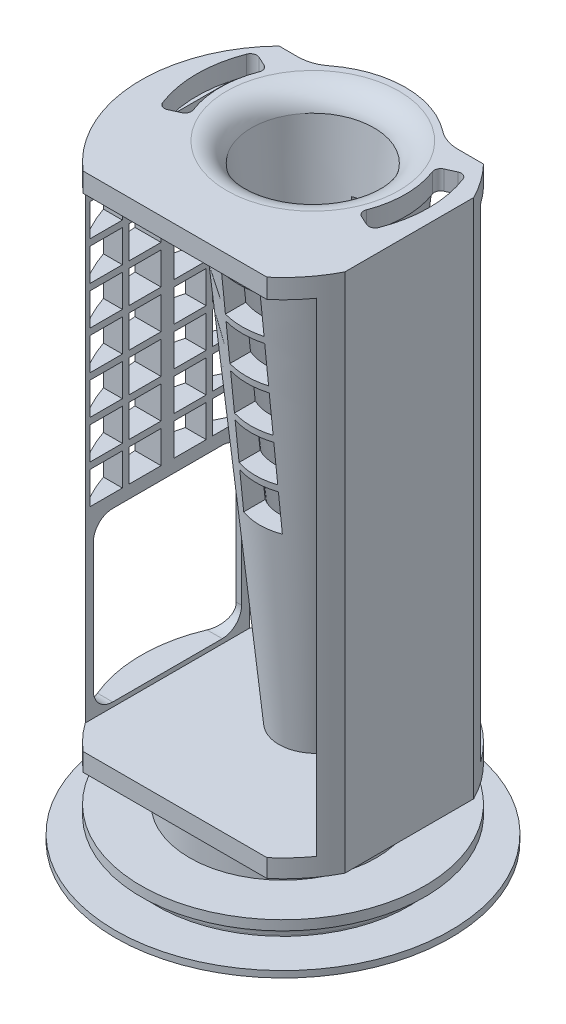
from build123d import *
from OCP.BRepFilletAPI import BRepFilletAPI_MakeChamfer

# Parameters (mm, degrees)
SKETCH_1_R                  = 9.5
EXTRUDE_1415_DEPTH          = 3
EXTRUDE_START               = -75
EXTRUDE_2148_DEPTH          = 75
EXTRUDE_START_2             = 2.8
EXTRUDE_2567_DEPTH          = 2.8
SKETCH_4_W                  = 5
SKETCH_4_H                  = 5
CUT_EXTRUDE_3719_DEPTH      = 89.815402046
CUT_EXTRUDE_4681_DEPTH      = 84.757719939
CUT_EXTRUDE_4681_DEPTH_BACK = 84.757719939
SKETCH_8_W                  = 6
SKETCH_8_H                  = 6
FILLET_4802_R               = 4
SKETCH_9_R                  = 14.480079495
EXTRUDE_4972_DEPTH          = 5.5
EXTRUDE_START_3             = 1.5
SKETCH_10_R                 = 22
EXTRUDE_5057_DEPTH          = 1.5
SKETCH_11_R                 = 19.5
EXTRUDE_5142_DEPTH          = 2.5
SKETCH_12_R                 = 26
EXTRUDE_5232_DEPTH          = 1
SKETCH_13_R                 = 12
CUT_EXTRUDE_5309_DEPTH      = 11
CHAMFER_5348_SIZE           = 8
CHAMFER_5348_SIZE2          = 5
EXTRUDE_START_4             = 5
EXTRUDE_5618_DEPTH          = 3
CHAMFER_2_SIZE              = 2
CHAMFER_2_SIZE2             = 0.8
FILLET_1_R                  = 2
FILLET_2_R                  = 2.3


with BuildPart() as part:
    # Эскиз1 → Extrude 1415 (new body)
    with BuildSketch(Plane(origin=(0, 0, 0), x_dir=(1, 0, 0), z_dir=(0, 1, 0))):
        with BuildLine():
            Line((11.923898026, 15.25), (15.856780884, 15.25))
            ThreePointArc((15.856780884, 15.25), (17.922262053, 12.759017318), (19.6, 9.991996797))
            Line((19.6, 9.991996797), (19.6, -9.991996797))
            ThreePointArc((19.6, -9.991996797), (17.265454373, -13.63466484), (14.263151826, -16.75))
            Line((14.263151826, -16.75), (-14.263151826, -16.75))
            ThreePointArc((-14.263151826, -16.75), (-21.972769207, -1.094263859), (-15.856780884, 15.25))
            Line((-15.856780884, 15.25), (-12.923898026, 15.25))
            ThreePointArc((-12.923898026, 15.25), (-11.011274358, 15.568089332), (-9.304561701, 16.488112173))
            ThreePointArc((-9.304561701, 16.488112173), (-0.5, 19.5), (8.304561701, 16.488112173))
            ThreePointArc((8.304561701, 16.488112173), (10.011274358, 15.568089332), (11.923898026, 15.25))
        make_face()
        with Locations(Location((-0.5, 5.125, 0), (0, 0, 270))):
            Circle(SKETCH_1_R, mode=Mode.SUBTRACT)
        with BuildLine():
            ThreePointArc((-17.280882687, 11.649449245), (-18.504623343, 5.125), (-17.280882687, -1.399449245))
            ThreePointArc((-17.280882687, -1.399449245), (-16.724559325, -1.963810812), (-15.932291149, -1.946181296))
            Line((-15.932291149, -1.946181296), (-14.447945449, -1.266043949))
            ThreePointArc((-14.447945449, -1.266043949), (-13.938944916, -0.73553603), (-13.930228365, -0.000386918))
            ThreePointArc((-13.930228365, -0.000386918), (-14.875, 5.125), (-13.930228365, 10.250386918))
            ThreePointArc((-13.930228365, 10.250386918), (-13.938944916, 10.98553603), (-14.447945449, 11.516043949))
            Line((-14.447945449, 11.516043949), (-15.932291149, 12.196181296))
            ThreePointArc((-15.932291149, 12.196181296), (-16.724559325, 12.213810812), (-17.280882687, 11.649449245))
        make_face(mode=Mode.SUBTRACT)
        with BuildLine():
            ThreePointArc((16.280882687, 11.649449245), (15.724559325, 12.213810812), (14.932291149, 12.196181296))
            Line((14.932291149, 12.196181296), (13.447945449, 11.516043949))
            ThreePointArc((13.447945449, 11.516043949), (12.938944916, 10.98553603), (12.930228365, 10.250386918))
            ThreePointArc((12.930228365, 10.250386918), (13.875, 5.125), (12.930228365, -0.000386918))
            ThreePointArc((12.930228365, -0.000386918), (12.938944916, -0.73553603), (13.447945449, -1.266043949))
            Line((13.447945449, -1.266043949), (14.932291149, -1.946181296))
            ThreePointArc((14.932291149, -1.946181296), (15.724559325, -1.963810812), (16.280882687, -1.399449245))
            ThreePointArc((16.280882687, -1.399449245), (17.504623343, 5.125), (16.280882687, 11.649449245))
        make_face(mode=Mode.SUBTRACT)
    extrude(amount=EXTRUDE_1415_DEPTH)

    # Эскиз2 → Extrude 2148 (add)
    with BuildSketch(Plane(origin=(0, 0, 0), x_dir=(1, 0, 0), z_dir=(0, 1, 0)).offset(EXTRUDE_START)):
        with BuildLine():
            Line((-17.922262053, -12.759017318), (-17.922262053, 12.759017318))
            ThreePointArc((-17.922262053, 12.759017318), (-22, 0), (-17.922262053, -12.759017318))
        make_face()
        with BuildLine():
            Line((17.922262053, -12.759017318), (17.922262053, 12.759017318))
            ThreePointArc((17.922262053, 12.759017318), (18.812074262, 11.406395661), (19.6, 9.991996797))
            Line((19.6, 9.991996797), (19.6, -9.991996797))
            ThreePointArc((19.6, -9.991996797), (18.812074262, -11.406395661), (17.922262053, -12.759017318))
        make_face()
    extrude(amount=EXTRUDE_2148_DEPTH)

    # Эскиз3 → Extrude 2567 (add)
    with BuildSketch(Plane(origin=(0, -75, 0), x_dir=(-1, 0, 0), z_dir=(0, -1, 0)).offset(EXTRUDE_START_2)):
        with BuildLine():
            Line((-14.263151826, -16.75), (14.263151826, -16.75))
            ThreePointArc((14.263151826, -16.75), (21.972769207, -1.094263859), (15.856780884, 15.25))
            Line((15.856780884, 15.25), (-7.52226754, 20.674029386))
            ThreePointArc((-7.52226754, 20.674029386), (-14.575006147, 16.479356657), (-19.6, 9.991996797))
            Line((-19.6, 9.991996797), (-19.6, -9.991996797))
            ThreePointArc((-19.6, -9.991996797), (-17.265454373, -13.63466484), (-14.263151826, -16.75))
        make_face()
    extrude(amount=-EXTRUDE_2567_DEPTH)

    # Эскиз4 → Cut-Extrude 3719 (cut, through all)
    with BuildSketch(Plane(origin=(-17.922262053, 0, 0), x_dir=(0, 0, -1), z_dir=(1, 0, 0))):
        with BuildLine():
            Line((8.5, -74.3), (-8.5, -74.3))
            ThreePointArc((-8.5, -74.3), (-10.621320344, -73.421320344), (-11.5, -71.3))
            Line((-11.5, -71.3), (-11.5, -51.3))
            ThreePointArc((-11.5, -51.3), (-10.621320344, -49.178679656), (-8.5, -48.3))
            Line((-8.5, -48.3), (8.5, -48.3))
            ThreePointArc((8.5, -48.3), (10.621320344, -49.178679656), (11.5, -51.3))
            Line((11.5, -51.3), (11.5, -71.3))
            ThreePointArc((11.5, -71.3), (10.621320344, -73.421320344), (8.5, -74.3))
        make_face()
        with Locations((9.5, -43.8)):
            Rectangle(SKETCH_4_W, SKETCH_4_H)
        with Locations((3.5, -43.8)):
            Rectangle(SKETCH_4_W, SKETCH_4_H)
        with Locations((-3.5, -43.8)):
            Rectangle(SKETCH_4_W, SKETCH_4_H)
        with Locations((-9.5, -43.8)):
            Rectangle(SKETCH_4_W, SKETCH_4_H)
        with Locations((9.5, -37.8)):
            Rectangle(SKETCH_4_W, SKETCH_4_H)
        with Locations((3.5, -37.8)):
            Rectangle(SKETCH_4_W, SKETCH_4_H)
        with Locations((-3.5, -37.8)):
            Rectangle(SKETCH_4_W, SKETCH_4_H)
        with Locations((-9.5, -37.8)):
            Rectangle(SKETCH_4_W, SKETCH_4_H)
        with Locations((9.5, -31.8)):
            Rectangle(SKETCH_4_W, SKETCH_4_H)
        with Locations((3.5, -31.8)):
            Rectangle(SKETCH_4_W, SKETCH_4_H)
        with Locations((-3.5, -31.8)):
            Rectangle(SKETCH_4_W, SKETCH_4_H)
        with Locations((-9.5, -31.8)):
            Rectangle(SKETCH_4_W, SKETCH_4_H)
        with Locations((9.5, -25.8)):
            Rectangle(SKETCH_4_W, SKETCH_4_H)
        with Locations((3.5, -25.8)):
            Rectangle(SKETCH_4_W, SKETCH_4_H)
        with Locations((-3.5, -25.8)):
            Rectangle(SKETCH_4_W, SKETCH_4_H)
        with Locations((-9.5, -25.8)):
            Rectangle(SKETCH_4_W, SKETCH_4_H)
        with Locations((9.5, -19.8)):
            Rectangle(SKETCH_4_W, SKETCH_4_H)
        with Locations((3.5, -19.8)):
            Rectangle(SKETCH_4_W, SKETCH_4_H)
        with Locations((-3.5, -19.8)):
            Rectangle(SKETCH_4_W, SKETCH_4_H)
        with Locations((-9.5, -19.8)):
            Rectangle(SKETCH_4_W, SKETCH_4_H)
        with Locations((9.5, -13.8)):
            Rectangle(SKETCH_4_W, SKETCH_4_H)
        with Locations((3.5, -13.8)):
            Rectangle(SKETCH_4_W, SKETCH_4_H)
        with Locations((-3.5, -13.8)):
            Rectangle(SKETCH_4_W, SKETCH_4_H)
        with Locations((-9.5, -13.8)):
            Rectangle(SKETCH_4_W, SKETCH_4_H)
        with Locations((9.5, -7.8)):
            Rectangle(SKETCH_4_W, SKETCH_4_H)
        with Locations((3.5, -7.8)):
            Rectangle(SKETCH_4_W, SKETCH_4_H)
        with Locations((-3.5, -7.8)):
            Rectangle(SKETCH_4_W, SKETCH_4_H)
        with Locations((-9.5, -7.8)):
            Rectangle(SKETCH_4_W, SKETCH_4_H)
    extrude(amount=-CUT_EXTRUDE_3719_DEPTH, mode=Mode.SUBTRACT)

    # Эскиз7 → Revolve 4422 (revolve)
    with BuildSketch(Plane(origin=(0, 0, -5.125), x_dir=(-1, 0, 0), z_dir=(0, 0, -1)), mode=Mode.PRIVATE) as revolve_4422_sk:
        Polygon((2.735961845, -75), (10, 0), (13.014038155, 0), (5.75, -75), align=None)
    revolve(revolve_4422_sk.sketch.rotate(Axis((0, 0, -5.125), (0, -1, 0)), 270), axis=Axis((0, 0, -5.125), (0, -1, 0)))

    # Эскиз8 → Cut-Extrude 4681 (cut, two sides: drawn at the far end of the back side and taken through both)
    with BuildSketch(Plane(origin=(0, 0, -5.125), x_dir=(-1, 0, 0), z_dir=(0, 0, -1)).offset(-CUT_EXTRUDE_4681_DEPTH_BACK)):
        with Locations((0, -13)):
            Rectangle(SKETCH_8_W, SKETCH_8_H)
        with Locations((0, -20)):
            Rectangle(SKETCH_8_W, SKETCH_8_H)
        with Locations((0, -27)):
            Rectangle(SKETCH_8_W, SKETCH_8_H)
        with Locations((0, -34)):
            Rectangle(SKETCH_8_W, SKETCH_8_H)
        with Locations((0, -41)):
            Rectangle(SKETCH_8_W, SKETCH_8_H)
    extrude(amount=CUT_EXTRUDE_4681_DEPTH + CUT_EXTRUDE_4681_DEPTH_BACK, mode=Mode.SUBTRACT)

    # Fillet 4802
    # the kernel refuses this fillet: 4 mm, written as the material it takes off along each edge
    with BuildSketch(Plane(origin=(-0.5, 3, -5.125), x_dir=(0, 0, 1), z_dir=(-1, 0, 0))) as fillet_4802_piece_1:
        with BuildLine():
            CenterArc((13.372983346, -4), FILLET_4802_R, 90, 75.522487814)
            Line((9.5, -3), (9.422540333, -2.98))
            ThreePointArc((9.422540333, -2.98), (9.42, -1.5), (9.42, 0))
            Line((9.42, 0), (9.5, 0.08))
            Line((9.5, 0.08), (13.372983346, 0.08))
            Line((13.372983346, 0.08), (13.372983346, 0))
        make_face()
    revolve(axis=Axis((-0.5, 3, -5.125), (0, 1, 0)), mode=Mode.SUBTRACT)

    # Эскиз9 → Extrude 4972 (add)
    with BuildSketch(Plane.XZ.offset(77.8)):
        with Locations(Location((0, 0, 0), (0, 0, 270))):
            Circle(SKETCH_9_R)
    extrude(amount=EXTRUDE_4972_DEPTH)

    # Эскиз10 → Extrude 5057 (add)
    with BuildSketch(Plane.XZ.offset(83.3).offset(EXTRUDE_START_3)):
        with Locations(Location((0, 0, 0), (0, 0, 270))):
            Circle(SKETCH_10_R)
    extrude(amount=-EXTRUDE_5057_DEPTH)

    # Эскиз11 → Extrude 5142 (add)
    with BuildSketch(Plane.XZ.offset(84.8)):
        with Locations(Location((0, 0, 0), (0, 0, 270))):
            Circle(SKETCH_11_R)
    extrude(amount=EXTRUDE_5142_DEPTH)

    # Эскиз12 → Extrude 5232 (add)
    with BuildSketch(Plane(origin=(0, -87.3, 0), x_dir=(-1, 0, 0), z_dir=(0, -1, 0))):
        with Locations(Location((0, 0, 0), (0, 0, 90))):
            Circle(SKETCH_12_R)
    extrude(amount=EXTRUDE_5232_DEPTH)

    # Эскиз13 → Cut-Extrude 5309 (cut)
    with BuildSketch(Plane.XZ.offset(88.3)):
        with Locations(Location((0, 0, 0), (0, 0, 270))):
            Circle(SKETCH_13_R)
    extrude(amount=-CUT_EXTRUDE_5309_DEPTH, mode=Mode.SUBTRACT)

    # Chamfer 5348
    chamfer_5348_edges = [part.edges().sort_by_distance(p)[0] for p in [
        (0, -88.3, 12),
    ]]
    chamfer_5348_side = [part.faces().sort_by_distance(p)[0] for p in [
        (0, -88.3, 25.264608948),
    ]]
    chamfer(chamfer_5348_edges, length=CHAMFER_5348_SIZE, length2=CHAMFER_5348_SIZE2, reference=chamfer_5348_side[0])

    # Эскиз14 → Extrude 5618 (add)
    with BuildSketch(Plane.XZ.offset(77.3).offset(EXTRUDE_START_4)):
        with BuildLine():
            Line((-8, 9.604686356), (-7.36, 8.836311448))
            ThreePointArc((-7.36, 8.836311448), (0, 11.5), (7.36, 8.836311448))
            Line((7.36, 8.836311448), (8, 9.604686356))
            ThreePointArc((8, 9.604686356), (0, 12.5), (-8, 9.604686356))
        make_face()
        with BuildLine():
            Line((9.604686356, 8), (8.836311448, 7.36))
            ThreePointArc((8.836311448, 7.36), (11.5, 0), (8.836311448, -7.36))
            Line((8.836311448, -7.36), (9.604686356, -8))
            ThreePointArc((9.604686356, -8), (12.5, 0), (9.604686356, 8))
        make_face()
        with BuildLine():
            Line((8, -9.604686356), (7.36, -8.836311448))
            ThreePointArc((7.36, -8.836311448), (0, -11.5), (-7.36, -8.836311448))
            Line((-7.36, -8.836311448), (-8, -9.604686356))
            ThreePointArc((-8, -9.604686356), (0, -12.5), (8, -9.604686356))
        make_face()
        with BuildLine():
            Line((-9.604686356, -8), (-8.836311448, -7.36))
            ThreePointArc((-8.836311448, -7.36), (-11.5, 0), (-8.836311448, 7.36))
            Line((-8.836311448, 7.36), (-9.604686356, 8))
            ThreePointArc((-9.604686356, 8), (-12.5, 0), (-9.604686356, -8))
        make_face()
    extrude(amount=EXTRUDE_5618_DEPTH)

    # Фаска2: one chamfer whose edges measure the first distance from different faces: ONE call of the kernel's chamfer builder (chamfer() names one face for all edges)
    chamfer_2_edges_1 = [part.edges().sort_by_distance(p)[0] for p in [
        (11.5, -85.3, 0),
    ]]
    chamfer_2_side_1 = [part.faces().sort_by_distance(p)[0] for p in [
        (11.5, -83.8, 0),
    ]]
    chamfer_2_edges_2 = [part.edges().sort_by_distance(p)[0] for p in [
        (0, -85.3, -11.5),
    ]]
    chamfer_2_side_2 = [part.faces().sort_by_distance(p)[0] for p in [
        (0, -83.8, -11.5),
    ]]
    chamfer_2_edges_3 = [part.edges().sort_by_distance(p)[0] for p in [
        (-11.5, -85.3, 0),
    ]]
    chamfer_2_side_3 = [part.faces().sort_by_distance(p)[0] for p in [
        (-11.5, -83.8, 0),
    ]]
    chamfer_2_edges_4 = [part.edges().sort_by_distance(p)[0] for p in [
        (0, -85.3, 11.5),
    ]]
    chamfer_2_side_4 = [part.faces().sort_by_distance(p)[0] for p in [
        (0, -83.8, 11.5),
    ]]
    chamfer_2 = BRepFilletAPI_MakeChamfer(part.part.solid().wrapped)
    for e in chamfer_2_edges_1:
        chamfer_2.Add(CHAMFER_2_SIZE, CHAMFER_2_SIZE2, e.wrapped, chamfer_2_side_1[0].wrapped)  # the first distance lies on this face
    for e in chamfer_2_edges_2:
        chamfer_2.Add(CHAMFER_2_SIZE, CHAMFER_2_SIZE2, e.wrapped, chamfer_2_side_2[0].wrapped)  # the first distance lies on this face
    for e in chamfer_2_edges_3:
        chamfer_2.Add(CHAMFER_2_SIZE, CHAMFER_2_SIZE2, e.wrapped, chamfer_2_side_3[0].wrapped)  # the first distance lies on this face
    for e in chamfer_2_edges_4:
        chamfer_2.Add(CHAMFER_2_SIZE, CHAMFER_2_SIZE2, e.wrapped, chamfer_2_side_4[0].wrapped)  # the first distance lies on this face
    add(Compound.cast(chamfer_2.Shape()), mode=Mode.REPLACE)

    # Скругление1
    fillet_1_edges = [part.edges().sort_by_distance(p)[0] for p in [
        (0, -77.8, 14.480079495),
    ]]
    fillet(fillet_1_edges, radius=FILLET_1_R)

    # Скругление2
    fillet_2_edges = [part.edges().sort_by_distance(p)[0] for p in [
        (0, -84.8, 19.5),
    ]]
    fillet(fillet_2_edges, radius=FILLET_2_R)


solid = part.part
